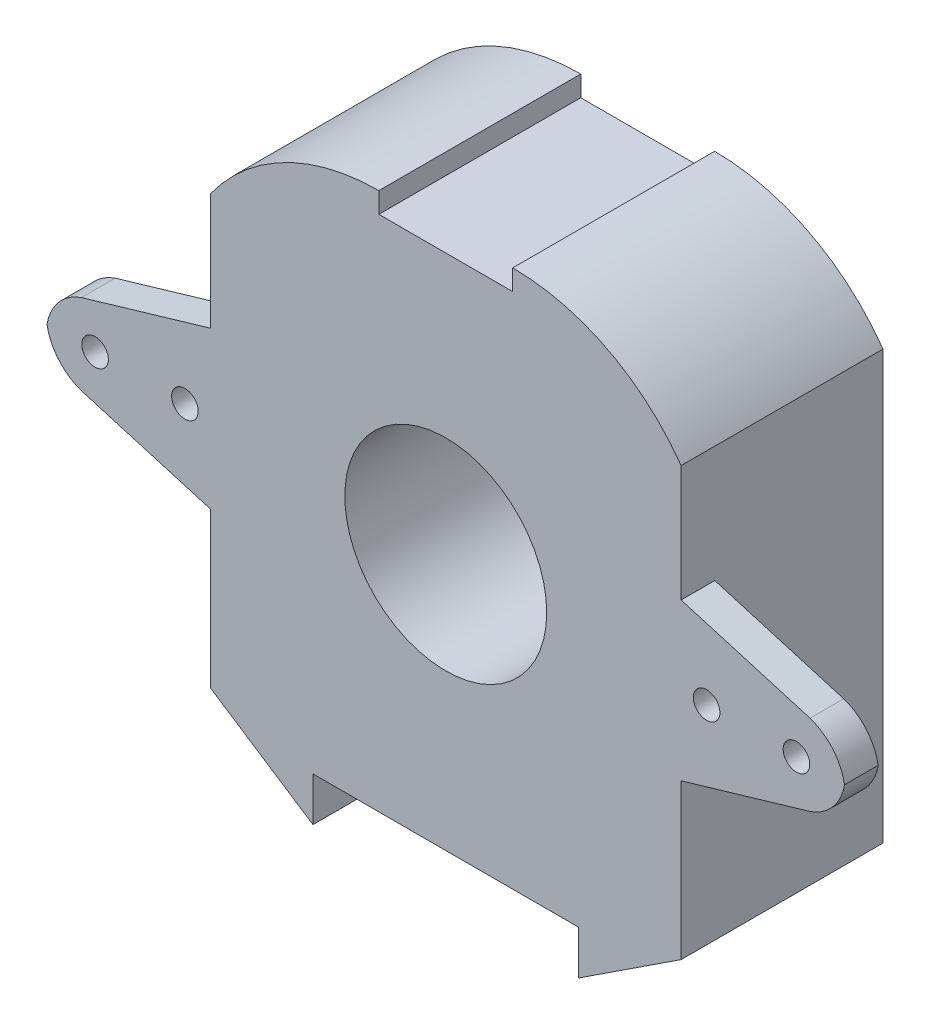
from build123d import *

# Parameters (mm, degrees)
BOSS_EXTRUDE2_DEPTH     = 15.24
SKETCH5_R               = 7.62
CUT_EXTRUDE2_DEPTH      = 15.24
BOSS_EXTRUDE3_DEPTH     = 2.54
CUT_EXTRUDE5_DEPTH      = 41.652633663
CUT_EXTRUDE5_DEPTH_BACK = 41.652633663
SKETCH7_R               = 1.0033


with BuildPart() as part:
    # Sketch1 → Boss-Extrude2 (new body)
    with BuildSketch(Plane.XY):
        with BuildLine():
            Line((-17.763499893, 14.683044609), (-17.763499893, -17.608986031))
            Line((-17.763499893, -17.608986031), (-10.024087591, -22.679635471))
            Line((-10.024087591, -22.679635471), (-10.024087591, -19.359490178))
            Line((-10.024087591, -19.359490178), (10.024087591, -19.359490178))
            Line((10.024087591, -19.359490178), (10.024087591, -22.679635471))
            Line((10.024087591, -22.679635471), (17.763499893, -17.608986031))
            Line((17.763499893, -17.608986031), (17.763499893, 14.683044609))
            ThreePointArc((17.763499893, 14.683044609), (12.2054587, 19.511759091), (5.051122326, 21.250660037))
            Line((5.051122326, 21.250660037), (5.051122326, 19.699745061))
            Line((5.051122326, 19.699745061), (-5.051122326, 19.699745061))
            Line((-5.051122326, 19.699745061), (-5.051122326, 21.250660037))
            ThreePointArc((-5.051122326, 21.250660037), (-12.2054587, 19.511759091), (-17.763499893, 14.683044609))
        make_face()
    extrude(amount=BOSS_EXTRUDE2_DEPTH)

    # Sketch5 → Cut-Extrude2 (cut)
    with BuildSketch(Plane.XY.offset(15.24)):
        Circle(SKETCH5_R)
    extrude(amount=-CUT_EXTRUDE2_DEPTH, mode=Mode.SUBTRACT)

    # Sketch6 → Boss-Extrude3 (add)
    with BuildSketch(Plane.XY.offset(15.24)):
        with BuildLine():
            Line((-27.497120647, 3.03730764), (-17.763499893, 5.900096548))
            Line((-17.763499893, 5.900096548), (-17.763499893, -5.920973667))
            Line((-17.763499893, -5.920973667), (-27.497120647, -3.058184758))
            ThreePointArc((-27.497120647, -3.058184758), (-29.216566103, -1.891287663), (-30.10005247, -0.010438559))
            ThreePointArc((-30.10005247, -0.010438559), (-29.216566103, 1.870410544), (-27.497120647, 3.03730764))
        make_face()
        with BuildLine():
            Line((27.497120647, 3.03730764), (17.763499893, 5.900096548))
            Line((17.763499893, 5.900096548), (17.763499893, -5.920973667))
            Line((17.763499893, -5.920973667), (27.497120647, -3.058184758))
            ThreePointArc((27.497120647, -3.058184758), (29.216566103, -1.891287663), (30.10005247, -0.010438559))
            ThreePointArc((30.10005247, -0.010438559), (29.216566103, 1.870410544), (27.497120647, 3.03730764))
        make_face()
    extrude(amount=-BOSS_EXTRUDE3_DEPTH)

    # Sketch7 → Cut-Extrude5 (cut, two sides: drawn at the far end of the back side and taken through both)
    with BuildSketch(Plane(origin=(0, 0, 0), x_dir=(-1, 0, 0), z_dir=(0, 0, -1)).offset(-CUT_EXTRUDE5_DEPTH_BACK)):
        with Locations((-19.688084634, 0)):
            Circle(SKETCH7_R)
        with Locations((-26.468771126, 0)):
            Circle(SKETCH7_R)
        with Locations((19.688084634, 0)):
            Circle(SKETCH7_R)
        with Locations((26.468771126, 0)):
            Circle(SKETCH7_R)
    extrude(amount=CUT_EXTRUDE5_DEPTH + CUT_EXTRUDE5_DEPTH_BACK, mode=Mode.SUBTRACT)


solid = part.part
